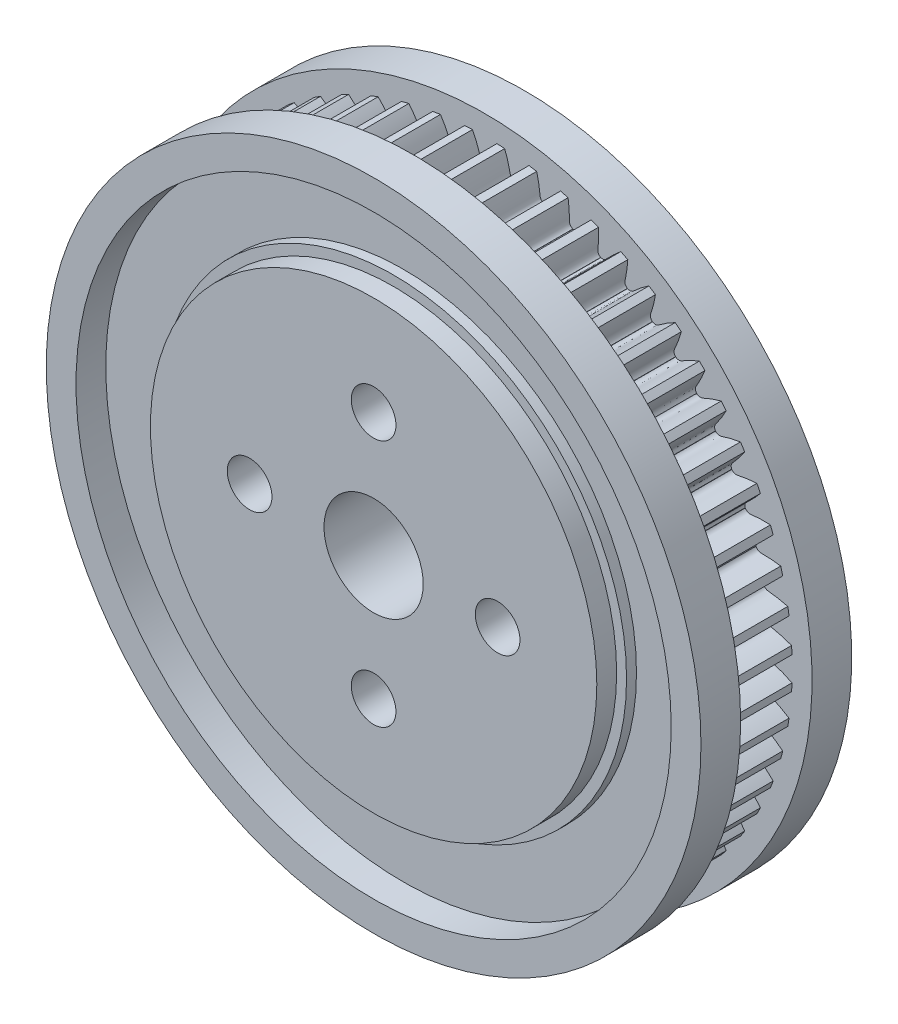
from build123d import *

# Parameters (mm, degrees)
SKETCH_1_R               = 31
EXTRUDE_1_DEPTH          = 7.2
CUT_EXTRUDE_1_DEPTH      = 45.42791915
PATTERN_CIRCULAR_1_COUNT = 60
SKETCH_4_R               = 33
EXTRUDE_2_DEPTH          = 4
SKETCH_5_R               = 30
SKETCH_5_R_2             = 22.5
CUT_EXTRUDE_2_DEPTH      = 3
EXTRUDE_START            = 1
SKETCH_A_R               = 23.5
SKETCH_A_R_2             = 22.5
EXTRUDE_3_DEPTH          = 1
EXTRUDE_START_2          = 4
SKETCH_8_R               = 33
EXTRUDE_4_DEPTH          = 4
CUT_EXTRUDE_START        = -2
SKETCH_9_R               = 30
CUT_EXTRUDE_3_DEPTH      = 2
SKETCH_10_R              = 5
SKETCH_10_R_2            = 1.6
CUT_EXTRUDE_4_DEPTH      = 50.081972385
SKETCH_11_R              = 2.25
CUT_EXTRUDE_5_DEPTH      = 4


with BuildPart() as part:
    # 草图1 → 凸台-拉伸1 (new body)
    with BuildSketch(Plane.XY):
        Circle(SKETCH_1_R)
    extrude(amount=EXTRUDE_1_DEPTH)

    # 草图2 → 切除-拉伸1 (cut, through all)
    with BuildSketch(Plane.XY):
        with BuildLine():
            ThreePointArc((0.01, 28.749955146), (0, 28.749956885), (-0.01, 28.749955146))
            add(Edge.make_bspline(
                [(-0.01, 28.749955146), (-0.429486861, 28.819346682), (-0.495837594, 29.165510951), (-0.623870472, 29.550234202), (-0.684032437, 29.723155344), (-0.751857968, 29.905235087), (-0.827366852, 30.09646236), (-0.911058345, 30.296531075), (-1.003283142, 30.505205894), (-1.104426215, 30.722215721), (-1.214853301, 30.947284868), (-1.334925974, 31.18012428), (-1.464996911, 31.420434309), (-1.605410859, 31.667904179), (-1.756503978, 31.922212404), (-1.918603646, 32.183026949), (-2.092028155, 32.450005472), (-2.277086427, 32.722795549), (-2.474077745, 33.001034914), (-2.683291482, 33.284351708), (-2.905006832, 33.57236473), (-3.139492582, 33.864683697), (-3.387006745, 34.160909512), (-3.739661599, 34.566214433), (-4.017144851, 34.866196888), (-4.208552041, 35.065218488)],
                knots=[0, 0, 0, 0, 0.112555337, 0.134959594, 0.158834787, 0.184180916, 0.210997981, 0.239285981, 0.269044917, 0.300274789, 0.332975596, 0.367147339, 0.402790018, 0.439903633, 0.478488184, 0.51854367, 0.560070092, 0.60306745, 0.647535744, 0.693474973, 0.740885138, 0.789766239, 0.840118276, 0.891941248, 1, 1, 1, 1], degree=3))
            ThreePointArc((-4.208552041, 35.065218488), (0, 35.316872142), (4.208552041, 35.065218488))
            add(Edge.make_bspline(
                [(0.01, 28.749955146), (0.429486861, 28.819346682), (0.495837594, 29.165510951), (0.623870472, 29.550234202), (0.684032437, 29.723155344), (0.751857968, 29.905235087), (0.827366852, 30.09646236), (0.911058345, 30.296531075), (1.003283142, 30.505205894), (1.104426215, 30.722215721), (1.214853301, 30.947284868), (1.334925974, 31.18012428), (1.464996911, 31.420434309), (1.605410859, 31.667904179), (1.756503978, 31.922212404), (1.918603646, 32.183026949), (2.092028155, 32.450005472), (2.277086427, 32.722795549), (2.474077745, 33.001034914), (2.683291482, 33.284351708), (2.905006832, 33.57236473), (3.139492582, 33.864683697), (3.387006745, 34.160909512), (3.739661599, 34.566214433), (4.017144851, 34.866196888), (4.208552041, 35.065218488)],
                knots=[0, 0, 0, 0, 0.112555337, 0.134959594, 0.158834787, 0.184180916, 0.210997981, 0.239285981, 0.269044917, 0.300274789, 0.332975596, 0.367147339, 0.402790018, 0.439903633, 0.478488184, 0.51854367, 0.560070092, 0.60306745, 0.647535744, 0.693474973, 0.740885138, 0.789766239, 0.840118276, 0.891941248, 1, 1, 1, 1], degree=3))
        make_face()
    cut_extrude_1 = extrude(amount=CUT_EXTRUDE_1_DEPTH, mode=Mode.SUBTRACT)

    # 阵列(圆周)1: 切除-拉伸1 ×60 about axis
    pattern_circular_1_axis = Axis((0, 0, -0.35), (0, 0, 1))
    for i in range(1, PATTERN_CIRCULAR_1_COUNT):
        add(cut_extrude_1.rotate(pattern_circular_1_axis, i * 360 / PATTERN_CIRCULAR_1_COUNT), mode=Mode.SUBTRACT)

    # 草图4 → 凸台-拉伸2 (add)
    with BuildSketch(Plane.XY.offset(7.2)):
        Circle(SKETCH_4_R)
    extrude(amount=EXTRUDE_2_DEPTH)

    # 草图5 → 切除-拉伸2 (cut)
    with BuildSketch(Plane.XY.offset(11.2)):
        Circle(SKETCH_5_R)
        Circle(SKETCH_5_R_2, mode=Mode.SUBTRACT)
    extrude(amount=-CUT_EXTRUDE_2_DEPTH, mode=Mode.SUBTRACT)

    # a → 凸台-拉伸3 (add)
    with BuildSketch(Plane.XY.offset(8.2).offset(EXTRUDE_START)):
        Circle(SKETCH_A_R)
        Circle(SKETCH_A_R_2, mode=Mode.SUBTRACT)
    extrude(amount=-EXTRUDE_3_DEPTH)

    # 草图8 → 凸台-拉伸4 (add)
    with BuildSketch(Plane(origin=(0, 0, 0), x_dir=(-1, 0, 0), z_dir=(0, 0, -1)).offset(EXTRUDE_START_2)):
        Circle(SKETCH_8_R)
    extrude(amount=-EXTRUDE_4_DEPTH)

    # 草图9 → 切除-拉伸3 (cut)
    with BuildSketch(Plane(origin=(0, 0, -4), x_dir=(-1, 0, 0), z_dir=(0, 0, -1)).offset(CUT_EXTRUDE_START)):
        Circle(SKETCH_9_R)
    extrude(amount=CUT_EXTRUDE_3_DEPTH, mode=Mode.SUBTRACT)

    # 草图10 → 切除-拉伸4 (cut, through all)
    with BuildSketch(Plane.XY.offset(11.2)):
        Circle(SKETCH_10_R)
        with Locations((0, 12.5)):
            Circle(SKETCH_10_R_2)
        with Locations((12.5, 0)):
            Circle(SKETCH_10_R_2)
        with Locations((0, -12.5)):
            Circle(SKETCH_10_R_2)
        with Locations((-12.5, 0)):
            Circle(SKETCH_10_R_2)
    extrude(amount=-CUT_EXTRUDE_4_DEPTH, mode=Mode.SUBTRACT)

    # 草图11 → 切除-拉伸5 (cut)
    with BuildSketch(Plane.XY.offset(11.2)):
        with Locations((0, 12.5)):
            Circle(SKETCH_11_R)
        with Locations((12.5, 0)):
            Circle(SKETCH_11_R)
        with Locations((0, -12.5)):
            Circle(SKETCH_11_R)
        with Locations((-12.5, 0)):
            Circle(SKETCH_11_R)
    extrude(amount=-CUT_EXTRUDE_5_DEPTH, mode=Mode.SUBTRACT)


solid = part.part
